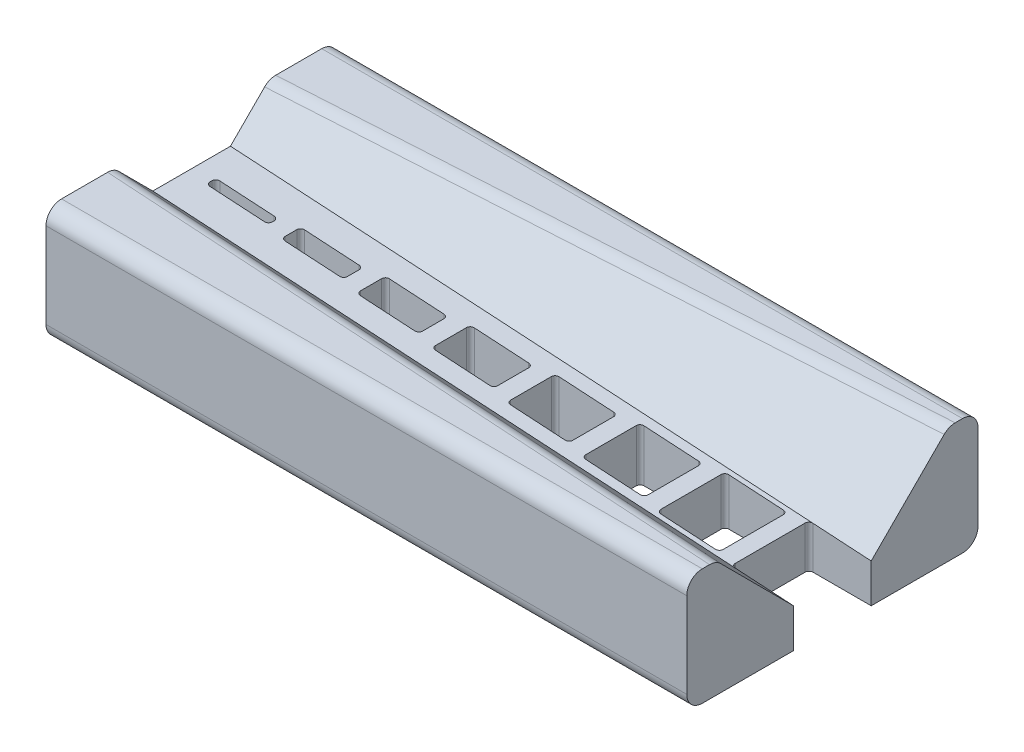
from build123d import *

# Parameters (mm, degrees)
BOSS_EXTRUDE1_DEPTH = 38.1
SKETCH2_W           = 209.55
SKETCH2_H           = 38.1
BOSS_EXTRUDE2_DEPTH = 9.525
SKETCH3_W           = 20.32
SKETCH3_H           = 3.175
SKETCH3_H_2         = 6.35
SKETCH3_H_3         = 9.525
SKETCH3_H_4         = 12.7
SKETCH3_H_5         = 15.875
SKETCH3_H_6         = 19.05
SKETCH3_H_7         = 22.225
SKETCH3_H_8         = 25.4
CUT_EXTRUDE1_DEPTH  = 123.141181515
CHAMFER1_SIZE       = 25.4
CHAMFER2_SIZE       = 25.4
FILLET1_R           = 1.27
FILLET2_R           = 5.08


with BuildPart() as part:
    # Sketch1 → Boss-Extrude1 (new, symmetric)
    with BuildSketch(Plane.XY):
        Polygon((-105.823993484, 0), (103.726006516, 0), (103.726006516, 12.7), (-105.823993484, 25.4), align=None)
    extrude(amount=BOSS_EXTRUDE1_DEPTH, both=True)

    # Sketch2 → Boss-Extrude2 (add)
    with BuildSketch(Plane(origin=(0, 0, -38.1), x_dir=(-1, 0, 0), z_dir=(0, 0, -1))):
        with Locations((1.048993484, 19.05)):
            Rectangle(SKETCH2_W, SKETCH2_H)
    boss_extrude2 = extrude(amount=BOSS_EXTRUDE2_DEPTH)

    # Mirror1: Boss-Extrude2 across plane
    add(boss_extrude2.mirror(Plane.XY))

    # Sketch3 → Cut-Extrude1 (cut, through all)
    with BuildSketch(Plane.XZ):
        with Locations((-89.313993484, 0)):
            Rectangle(SKETCH3_W, SKETCH3_H)
        with Locations((-63.151993484, 0)):
            Rectangle(SKETCH3_W, SKETCH3_H_2)
        with Locations((-36.989993484, 0)):
            Rectangle(SKETCH3_W, SKETCH3_H_3)
        with Locations((-10.827993484, 0)):
            Rectangle(SKETCH3_W, SKETCH3_H_4)
        with Locations((15.334006516, 0)):
            Rectangle(SKETCH3_W, SKETCH3_H_5)
        with Locations((41.496006516, 0)):
            Rectangle(SKETCH3_W, SKETCH3_H_6)
        with Locations((67.658006516, 0)):
            Rectangle(SKETCH3_W, SKETCH3_H_7)
        with Locations((93.566006516, 0)):
            Rectangle(SKETCH3_W, SKETCH3_H_8)
    extrude(amount=-CUT_EXTRUDE1_DEPTH, mode=Mode.SUBTRACT)

    # Chamfer1
    # the kernel refuses this chamfer: 25.4 mm, written as the material it adds along each edge
    with BuildSketch(Plane(origin=(168.92711924, 8.748417411, 38.1), x_dir=(0.060472188242602316, 0.9977911060029382, 0.02749587661058647), z_dir=(-0.9981684966311909, 0.06049506040189036, 0))) as chamfer1_piece_1_section:
        Polygon((CHAMFER1_SIZE * 0.999621916911, CHAMFER1_SIZE * 0.0274958766106), (-CHAMFER1_SIZE * 0.0274958766106, CHAMFER1_SIZE * 0.999621916911), (0, 0), align=None)
    chamfer1_piece_1 = extrude(amount=340.575991525, mode=Mode.PRIVATE)
    chamfer1_piece_1 = split(chamfer1_piece_1, bisect_by=Plane(origin=(103.726006516, 21.644739683, 29.711789503), z_dir=(-1, 0, 0)), keep=Keep.TOP, mode=Mode.PRIVATE)
    chamfer1_piece_1 = split(chamfer1_piece_1, bisect_by=Plane(origin=(93.576497018, 21.644739683, 12.7), z_dir=(0, 0, 1)), keep=Keep.TOP, mode=Mode.PRIVATE)
    chamfer1_piece_1 = split(chamfer1_piece_1, bisect_by=Plane(origin=(83.406006516, 21.644739683, 29.711789503), z_dir=(1, 0, 0)), keep=Keep.TOP, mode=Mode.PRIVATE)
    chamfer1_piece_1 = split(chamfer1_piece_1, bisect_by=Plane(origin=(93.576497018, 38.1, 29.711789503), z_dir=(0, -1, 0)), keep=Keep.TOP, mode=Mode.PRIVATE)
    add(chamfer1_piece_1)
    with BuildSketch(Plane(origin=(168.92711924, 8.748417411, 38.1), x_dir=(0.060472188242602316, 0.9977911060029382, 0.02749587661058647), z_dir=(-0.9981684966311909, 0.06049506040189036, 0))) as chamfer1_piece_2_section:
        Polygon((CHAMFER1_SIZE * 0.999621916911, CHAMFER1_SIZE * 0.0274958766106), (-CHAMFER1_SIZE * 0.0274958766106, CHAMFER1_SIZE * 0.999621916911), (0, 0), align=None)
    chamfer1_piece_2 = extrude(amount=340.575991525, mode=Mode.PRIVATE)
    chamfer1_piece_2 = split(chamfer1_piece_2, bisect_by=Plane(origin=(-105.823993484, 26.508792165, 29.076634432), z_dir=(1, 0, 0)), keep=Keep.TOP, mode=Mode.PRIVATE)
    chamfer1_piece_2 = split(chamfer1_piece_2, bisect_by=Plane(origin=(-6.816832876, 26.508792165, 12.7), z_dir=(0, 0, 1)), keep=Keep.TOP, mode=Mode.PRIVATE)
    chamfer1_piece_2 = split(chamfer1_piece_2, bisect_by=Plane(origin=(83.406006516, 26.508792165, 29.076634432), z_dir=(-1, 0, 0)), keep=Keep.TOP, mode=Mode.PRIVATE)
    chamfer1_piece_2 = split(chamfer1_piece_2, bisect_by=Plane(origin=(-6.816832876, 38.1, 29.076634432), z_dir=(0, -1, 0)), keep=Keep.TOP, mode=Mode.PRIVATE)
    add(chamfer1_piece_2)

    # Chamfer2
    # the kernel refuses this chamfer: 25.4 mm, written as the material it adds along each edge
    with BuildSketch(Plane(origin=(168.92711924, 8.748417411, -38.1), x_dir=(0.060472188242602316, 0.9977911060029382, -0.02749587661058647), z_dir=(-0.9981684966311909, 0.06049506040189036, 0))) as chamfer2_piece_1_section:
        Polygon((CHAMFER2_SIZE * 0.999621916911, -CHAMFER2_SIZE * 0.0274958766106), (-CHAMFER2_SIZE * 0.0274958766106, -CHAMFER2_SIZE * 0.999621916911), (0, 0), align=None)
    chamfer2_piece_1 = extrude(amount=340.575991525, mode=Mode.PRIVATE)
    chamfer2_piece_1 = split(chamfer2_piece_1, bisect_by=Plane(origin=(93.576497018, 38.1, -29.711789503), z_dir=(0, -1, 0)), keep=Keep.TOP, mode=Mode.PRIVATE)
    chamfer2_piece_1 = split(chamfer2_piece_1, bisect_by=Plane(origin=(103.726006516, 21.644739683, -29.711789503), z_dir=(-1, 0, 0)), keep=Keep.TOP, mode=Mode.PRIVATE)
    chamfer2_piece_1 = split(chamfer2_piece_1, bisect_by=Plane(origin=(93.576497018, 21.644739683, -12.7), z_dir=(0, 0, -1)), keep=Keep.TOP, mode=Mode.PRIVATE)
    chamfer2_piece_1 = split(chamfer2_piece_1, bisect_by=Plane(origin=(83.406006516, 21.644739683, -29.711789503), z_dir=(1, 0, 0)), keep=Keep.TOP, mode=Mode.PRIVATE)
    add(chamfer2_piece_1)
    with BuildSketch(Plane(origin=(168.92711924, 8.748417411, -38.1), x_dir=(0.060472188242602316, 0.9977911060029382, -0.02749587661058647), z_dir=(-0.9981684966311909, 0.06049506040189036, 0))) as chamfer2_piece_2_section:
        Polygon((CHAMFER2_SIZE * 0.999621916911, -CHAMFER2_SIZE * 0.0274958766106), (-CHAMFER2_SIZE * 0.0274958766106, -CHAMFER2_SIZE * 0.999621916911), (0, 0), align=None)
    chamfer2_piece_2 = extrude(amount=340.575991525, mode=Mode.PRIVATE)
    chamfer2_piece_2 = split(chamfer2_piece_2, bisect_by=Plane(origin=(-105.823993484, 26.508792165, -29.076634432), z_dir=(1, 0, 0)), keep=Keep.TOP, mode=Mode.PRIVATE)
    chamfer2_piece_2 = split(chamfer2_piece_2, bisect_by=Plane(origin=(-6.816832876, 38.1, -29.076634432), z_dir=(0, -1, 0)), keep=Keep.TOP, mode=Mode.PRIVATE)
    chamfer2_piece_2 = split(chamfer2_piece_2, bisect_by=Plane(origin=(-6.816832876, 26.508792165, -12.7), z_dir=(0, 0, -1)), keep=Keep.TOP, mode=Mode.PRIVATE)
    chamfer2_piece_2 = split(chamfer2_piece_2, bisect_by=Plane(origin=(83.406006516, 26.508792165, -29.076634432), z_dir=(-1, 0, 0)), keep=Keep.TOP, mode=Mode.PRIVATE)
    add(chamfer2_piece_2)

    # Fillet1
    fillet1_edges = [part.edges().sort_by_distance(p)[0] for p in [
        (-20.987993484, 10.129212121, -6.35),
        (-20.987993484, 10.129212121, 6.35),
        (-0.667993484, 9.513454545, 6.35),
        (-0.667993484, 9.513454545, -6.35),
        (5.174006516, 9.336424242, -7.9375),
        (5.174006516, 9.336424242, 7.9375),
        (25.494006516, 8.720666667, 7.9375),
        (25.494006516, 8.720666667, -7.9375),
        (31.336006516, 8.543636364, -9.525),
        (31.336006516, 8.543636364, 9.525),
        (51.656006516, 7.927878788, 9.525),
        (51.656006516, 7.927878788, -9.525),
        (57.498006516, 7.750848485, -11.1125),
        (57.498006516, 7.750848485, 11.1125),
        (77.818006516, 7.135090909, 11.1125),
        (77.818006516, 7.135090909, -11.1125),
        (83.406006516, 6.965757576, -12.7),
        (83.406006516, 6.965757576, 12.7),
        (-99.473993484, 12.507575758, 1.5875),
        (-79.153993484, 11.891818182, 1.5875),
        (-79.153993484, 11.891818182, -1.5875),
        (-99.473993484, 12.507575758, -1.5875),
        (-73.311993484, 11.714787879, -3.175),
        (-73.311993484, 11.714787879, 3.175),
        (-52.991993484, 11.099030303, 3.175),
        (-52.991993484, 11.099030303, -3.175),
        (-47.149993484, 10.922, -4.7625),
        (-47.149993484, 10.922, 4.7625),
        (-26.829993484, 10.306242424, 4.7625),
        (-26.829993484, 10.306242424, -4.7625),
    ]]
    fillet(fillet1_edges, radius=FILLET1_R)

    # Fillet2
    fillet2_edges = [part.edges().sort_by_distance(p)[0] for p in [
        (-1.048993484, 0, -47.625),
        (-1.048993484, 38.1, -47.625),
        (-1.048993484, 38.1, 31.715109861),
        (-1.048993484, 38.1, -31.715109861),
        (-1.048993484, 38.1, 47.625),
        (-1.048993484, 0, 47.625),
    ]]
    fillet(fillet2_edges, radius=FILLET2_R)


solid = part.part
